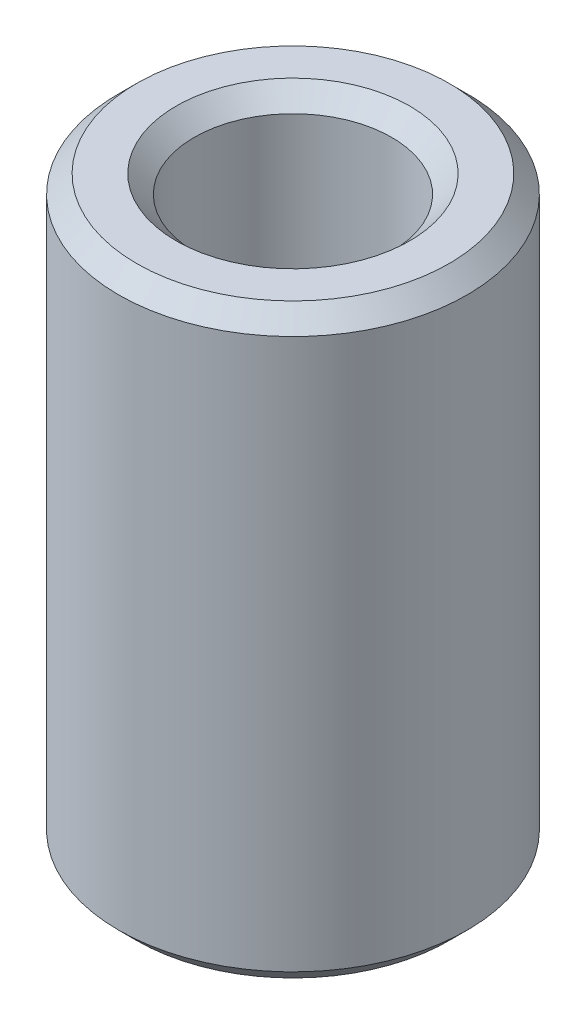
from build123d import *

# Parameters (mm, degrees)
SKETCH1_R           = 5
BOSS_EXTRUDE1_DEPTH = 16.82443875
SKETCH2_R           = 2.83353737
CUT_EXTRUDE1_DEPTH  = 19.249979157
CHAMFER1_SIZE       = 0.518395028


with BuildPart() as part:
    # Sketch1 → Boss-Extrude1 (new body)
    with BuildSketch(Plane(origin=(0, 0, 0), x_dir=(1, 0, 0), z_dir=(0, 1, 0))):
        Circle(SKETCH1_R)
    extrude(amount=BOSS_EXTRUDE1_DEPTH)

    # Sketch2 → Cut-Extrude1 (cut, through all)
    with BuildSketch(Plane(origin=(0, 0, 0), x_dir=(1, 0, 0), z_dir=(0, 1, 0))):
        Circle(SKETCH2_R)
    extrude(amount=CUT_EXTRUDE1_DEPTH, mode=Mode.SUBTRACT)

    # Chamfer1
    chamfer1_edges = [part.edges().sort_by_distance(p)[0] for p in [
        (-2.83353737, 16.82443875, 0),
        (-2.83353737, 0, 0),
        (-5, 0, 0),
        (-5, 16.82443875, 0),
    ]]
    chamfer(chamfer1_edges, length=CHAMFER1_SIZE)


solid = part.part
